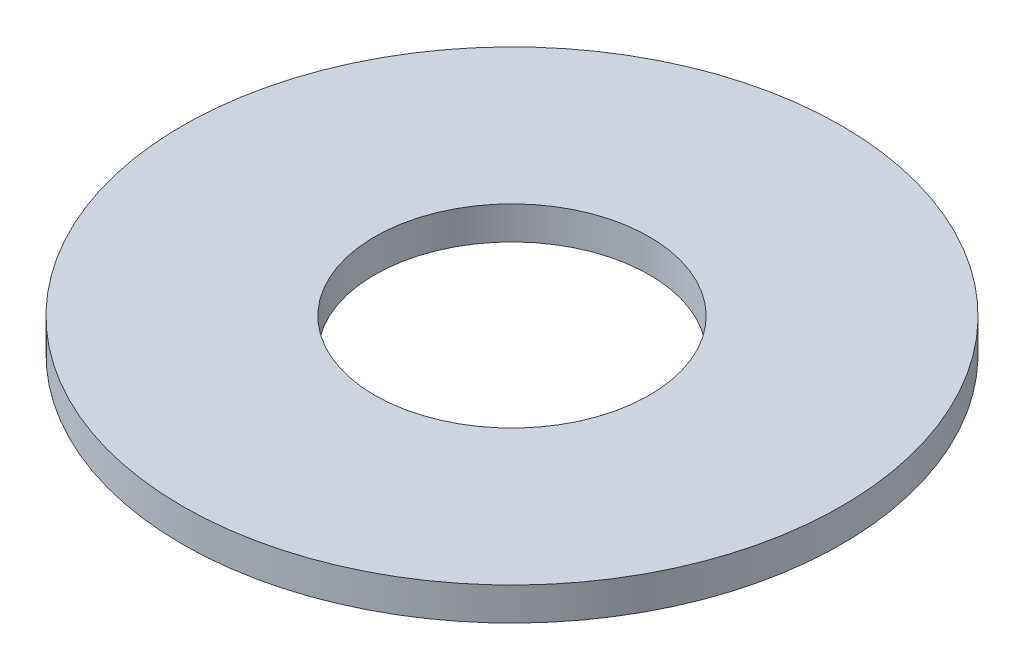
from build123d import *

# Parameters (mm, degrees)
SKETCH1_R           = 90
BOSS_EXTRUDE1_DEPTH = 9
SKETCH2_R           = 37.5
CUT_EXTRUDE1_DEPTH  = 128.597021909


with BuildPart() as part:
    # Sketch1 → Boss-Extrude1 (new body)
    with BuildSketch(Plane(origin=(0, 0, 0), x_dir=(1, 0, 0), z_dir=(0, 1, 0))):
        Circle(SKETCH1_R)
    extrude(amount=BOSS_EXTRUDE1_DEPTH)

    # Sketch2 → Cut-Extrude1 (cut, through all)
    with BuildSketch(Plane(origin=(0, 0, 0), x_dir=(1, 0, 0), z_dir=(0, 1, 0))):
        Circle(SKETCH2_R)
    extrude(amount=CUT_EXTRUDE1_DEPTH, mode=Mode.SUBTRACT)


solid = part.part
